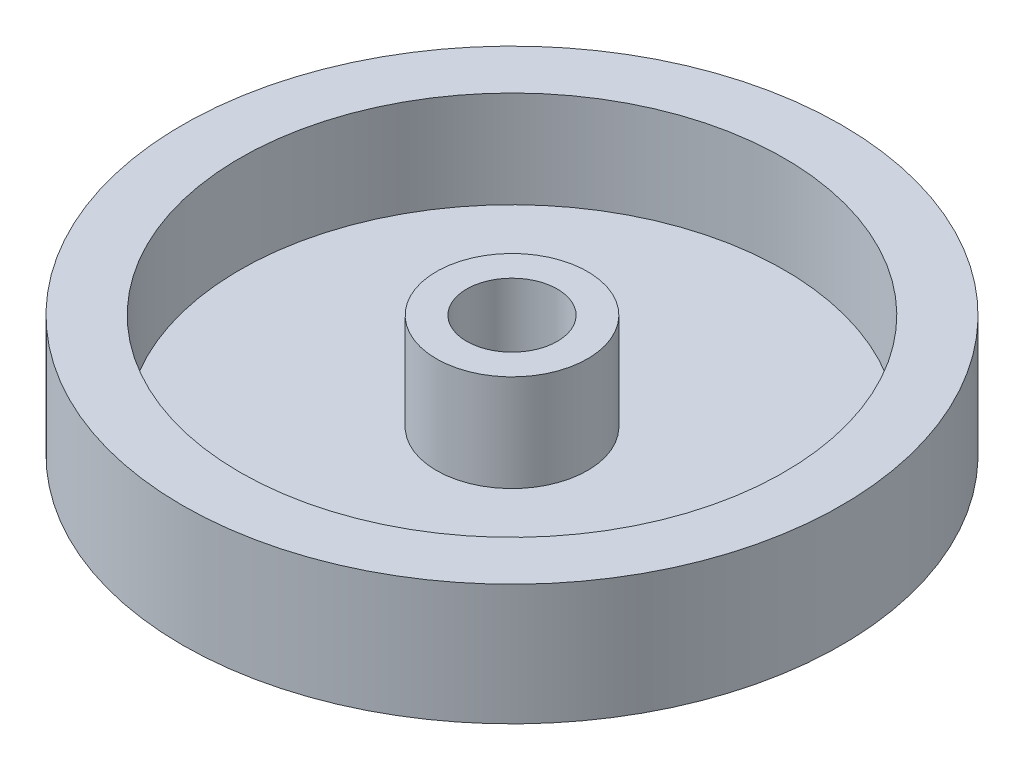
from build123d import *

# Parameters (mm, degrees)
SKETCH_1_R          = 10.9
EXTRUDE_1_DEPTH     = 4
SKETCH_2_R          = 9
SKETCH_2_R_2        = 2.5
CUT_EXTRUDE_2_DEPTH = 3.2
SKETCH_3_R          = 1.5
CUT_EXTRUDE_3_DEPTH = 16.925451328


with BuildPart() as part:
    # Эскиз1 → Вытянуть1 (new body)
    with BuildSketch(Plane(origin=(0, 0, 0), x_dir=(1, 0, 0), z_dir=(0, 1, 0))):
        Circle(SKETCH_1_R)
    extrude(amount=EXTRUDE_1_DEPTH)

    # Эскиз2 → Вытянуть2 (cut)
    with BuildSketch(Plane(origin=(0, 4, 0), x_dir=(1, 0, 0), z_dir=(0, 1, 0))):
        Circle(SKETCH_2_R)
        Circle(SKETCH_2_R_2, mode=Mode.SUBTRACT)
    extrude(amount=-CUT_EXTRUDE_2_DEPTH, mode=Mode.SUBTRACT)

    # Эскиз3 → Вытянуть3 (cut, through all)
    with BuildSketch(Plane(origin=(0, 4, 0), x_dir=(1, 0, 0), z_dir=(0, 1, 0))):
        Circle(SKETCH_3_R)
    extrude(amount=-CUT_EXTRUDE_3_DEPTH, mode=Mode.SUBTRACT)


solid = part.part
